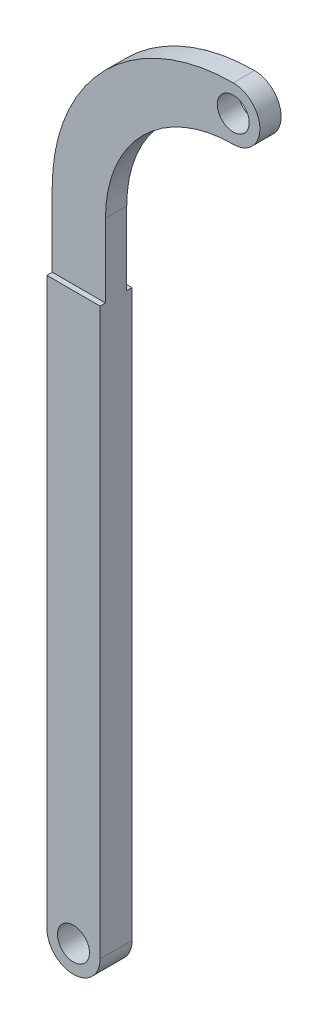
from build123d import *

# Parameters (mm, degrees)
SKETCH_1_R               = 1.5
EXTRUDE_1_DEPTH          = 3
CUT_EXTRUDE_1_DEPTH      = 79.911342657
CUT_EXTRUDE_1_DEPTH_BACK = 79.911342657
SKETCH_2_W               = 0.5
SKETCH_2_H               = 23.89994555
SKETCH_2_W_2             = 0.589580916


with BuildPart() as part:
    # 草图1 → 凸台-拉伸1 (new body)
    with BuildSketch(Plane.XY):
        with BuildLine():
            Line((-2.5, 0), (-2.5, 60))
            ThreePointArc((-2.5, 60), (2.47918472, 72.02081528), (14.5, 77))
            ThreePointArc((14.5, 77), (17, 74.5), (14.5, 72))
            ThreePointArc((14.5, 72), (6.014718626, 68.485281374), (2.5, 60))
            Line((2.5, 60), (2.5, 0))
            ThreePointArc((2.5, 0), (0, -2.5), (-2.5, 0))
        make_face()
        Circle(SKETCH_1_R, mode=Mode.SUBTRACT)
        with Locations((14.5, 74.5)):
            Circle(SKETCH_1_R, mode=Mode.SUBTRACT)
    extrude(amount=EXTRUDE_1_DEPTH)

    # 草图2 → 切除-拉伸1 (cut, two sides: drawn at the far end of the back side and taken through both)
    with BuildSketch(Plane(origin=(0, 0, 0), x_dir=(0, 0, -1), z_dir=(1, 0, 0)).offset(-CUT_EXTRUDE_1_DEPTH_BACK)):
        with Locations((-0.25, 65.050027225)):
            Rectangle(SKETCH_2_W, SKETCH_2_H)
        with Locations((-2.790044711, 65.050027225)):
            Rectangle(SKETCH_2_W_2, SKETCH_2_H)
    extrude(amount=CUT_EXTRUDE_1_DEPTH + CUT_EXTRUDE_1_DEPTH_BACK, mode=Mode.SUBTRACT)


solid = part.part
